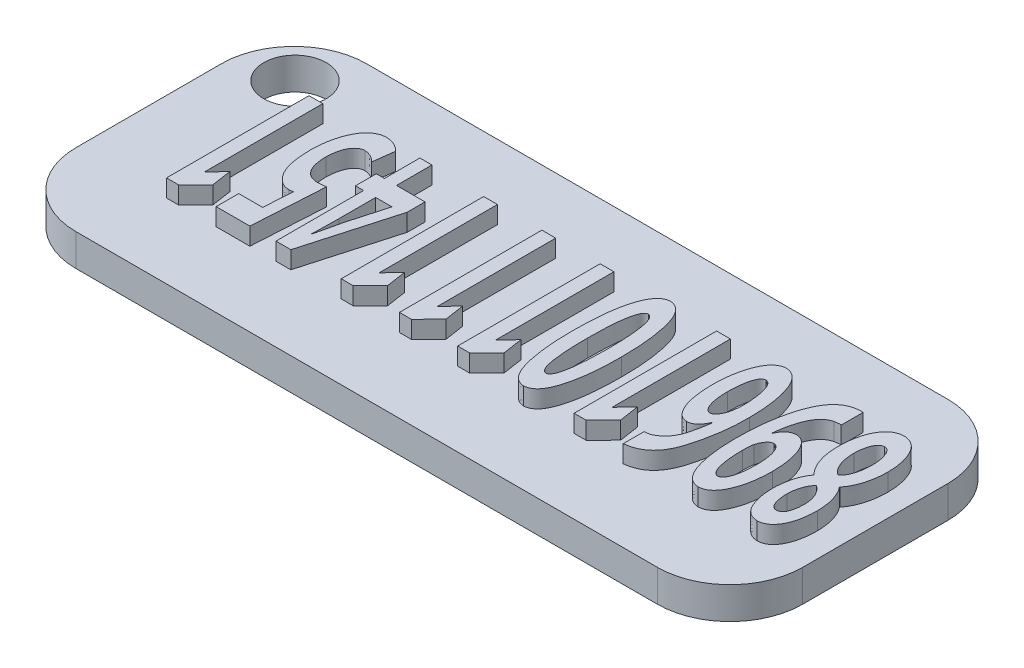
from build123d import *

# Parameters (mm, degrees)
SKETCH_1_W          = 50
SKETCH_1_H          = 20
EXTRUDE_1_DEPTH     = 2.2
FILLET_1_R          = 5
FILLET_2_R          = 5
FILLET_3_R          = 5
FILLET_4_R          = 5
SKETCH_4_R          = 2.151855383
CUT_EXTRUDE_1_DEPTH = 3
EXTRUDE_START       = -1.2
EXTRUDE_1056_DEPTH  = 1.2


# Read off the part's stored shape, not the designer's step: надпись
with BuildPart() as part:
    # Эскиз1 → Бобышка-Вытянуть1 (new body)
    with BuildSketch(Plane(origin=(0, 0, 0), x_dir=(1, 0, 0), z_dir=(0, 1, 0))):
        with Locations((25, 10)):
            Rectangle(SKETCH_1_W, SKETCH_1_H)
    extrude(amount=EXTRUDE_1_DEPTH)

    # Скругление1
    fillet_1_edges = [part.edges().sort_by_distance(p)[0] for p in [
        (0, 1.1, -20),
    ]]
    fillet(fillet_1_edges, radius=FILLET_1_R)

    # Скругление2
    fillet_2_edges = [part.edges().sort_by_distance(p)[0] for p in [
        (0, 1.1, 0),
    ]]
    fillet(fillet_2_edges, radius=FILLET_2_R)

    # Скругление3
    fillet_3_edges = [part.edges().sort_by_distance(p)[0] for p in [
        (50, 1.1, -20),
    ]]
    fillet(fillet_3_edges, radius=FILLET_3_R)

    # Скругление4
    fillet_4_edges = [part.edges().sort_by_distance(p)[0] for p in [
        (50, 1.1, 0),
    ]]
    fillet(fillet_4_edges, radius=FILLET_4_R)

    # Эскиз4 → Вырез-Вытянуть1 (cut)
    with BuildSketch(Plane(origin=(0, 2.2, 0), x_dir=(1, 0, 0), z_dir=(0, 1, 0))):
        with Locations(Location((3.542470198, 16.528352227, 0), (0, 0, 270))):
            Circle(SKETCH_4_R)
    extrude(amount=-CUT_EXTRUDE_1_DEPTH, mode=Mode.SUBTRACT)

    # Extrude 1056 outline → Extrude 1056 (add)
    # profile 1 of 11: a face of its own
    with BuildSketch(Plane.XZ.offset(-2.2).offset(EXTRUDE_START)):
        with BuildLine():
            add(Edge.make_bspline(
                [(46.078309947, -9.677843866), (46.027974113, -9.605172508), (45.925734825, -9.457566573), (45.797719515, -9.21403545), (45.690766361, -8.949790128), (45.605330166, -8.667262078), (45.538818282, -8.374682095), (45.489532793, -8.076942657), (45.45786786, -7.777208198), (45.454564992, -7.576119586), (45.452912137, -7.475488811)],
                knots=[0, 0, 0, 0, 0.113941103, 0.2314307, 0.353960198, 0.481139313, 0.611706454, 0.740704099, 0.870240551, 1, 1, 1, 1], degree=3))
            Line((46.078309947, -9.677843866), (46.078854937, -9.703996008))
            add(Edge.make_bspline(
                [(45.211584793, -12.207767208), (45.21631399, -12.061200702), (45.225433942, -11.778556663), (45.273766155, -11.372768263), (45.352120596, -11.002667897), (45.459635252, -10.669550107), (45.589719445, -10.373513923), (45.734618791, -10.113421233), (45.894005329, -9.888382936), (46.01865144, -9.764048816), (46.078854937, -9.703996008)],
                knots=[0, 0, 0, 0, 0.161686258, 0.311801503, 0.450067459, 0.578302134, 0.697174596, 0.806108895, 0.906351489, 1, 1, 1, 1], degree=3))
            add(Edge.make_bspline(
                [(46.863168807, -15.113122193), (46.80262288, -15.109171079), (46.684044908, -15.101432903), (46.511067483, -15.060678112), (46.347933835, -14.995360647), (46.191896755, -14.909032346), (46.047301537, -14.794897335), (45.911617757, -14.658556004), (45.784541788, -14.498597289), (45.668579213, -14.315558168), (45.563753042, -14.112223731), (45.470997983, -13.891170782), (45.394091896, -13.651866208), (45.330756558, -13.395988548), (45.279593831, -13.122797621), (45.242938773, -12.833195306), (45.217255905, -12.526213109), (45.213510802, -12.315917003), (45.211584793, -12.207767208)],
                knots=[0, 0, 0, 0, 0.04935732, 0.096665312, 0.144003759, 0.192132698, 0.241383724, 0.293506514, 0.348508342, 0.407438452, 0.469713062, 0.534644972, 0.602472394, 0.674232576, 0.749229871, 0.828723586, 0.911917015, 1, 1, 1, 1], degree=3))
            add(Edge.make_bspline(
                [(48.454420985, -12.428355484), (48.452674256, -12.516993812), (48.449226519, -12.691950305), (48.430923326, -12.949468758), (48.398000408, -13.197850059), (48.355874941, -13.436766086), (48.298960072, -13.665970943), (48.22900655, -13.885768002), (48.146139953, -14.095954879), (48.053448211, -14.295680741), (47.946991827, -14.478130498), (47.827908731, -14.639709615), (47.697781171, -14.778860945), (47.554387512, -14.893967333), (47.398514091, -14.984872048), (47.231251794, -15.053623861), (47.051286399, -15.097807415), (46.926883157, -15.107935165), (46.863168807, -15.113122193)],
                knots=[0, 0, 0, 0, 0.077214743, 0.152408342, 0.224719305, 0.295370231, 0.363611314, 0.430261871, 0.496132333, 0.560288229, 0.621875218, 0.679791288, 0.734777273, 0.787353525, 0.839365363, 0.891411757, 0.944385459, 1, 1, 1, 1], degree=3))
            add(Edge.make_bspline(
                [(47.695145343, -9.85936227), (47.747554237, -9.926459085), (47.856031089, -10.065337253), (47.992318934, -10.306361212), (48.120543883, -10.577558027), (48.235291236, -10.883599416), (48.332007715, -11.222904393), (48.400135986, -11.596003837), (48.444033938, -12.001236193), (48.450872319, -12.282433004), (48.454420985, -12.428355484)],
                knots=[0, 0, 0, 0, 0.093486626, 0.193500263, 0.303527542, 0.423128014, 0.552388557, 0.690879033, 0.839586736, 1, 1, 1, 1], degree=3))
            Line((47.695145343, -9.85936227), (47.696502294, -9.820888941))
            add(Edge.make_bspline(
                [(48.333757313, -7.669681908), (48.332400882, -7.773485108), (48.329714157, -7.979091408), (48.294470298, -8.282880004), (48.248183965, -8.579721921), (48.175551215, -8.86483122), (48.087174996, -9.135586497), (47.976756913, -9.385857701), (47.850277624, -9.616246555), (47.747160445, -9.753473674), (47.696502294, -9.820888941)],
                knots=[0, 0, 0, 0, 0.136247325, 0.26986941, 0.401216199, 0.530532356, 0.655813574, 0.774814705, 0.889373711, 1, 1, 1, 1], degree=3))
            add(Edge.make_bspline(
                [(46.853741958, -5.003768899), (46.90797993, -5.007260305), (47.014463515, -5.014114866), (47.169787234, -5.050784431), (47.315929588, -5.110360712), (47.455258419, -5.189599), (47.583778459, -5.293674812), (47.705715522, -5.417268753), (47.817999658, -5.563759963), (47.924291395, -5.729516874), (48.016616167, -5.916192509), (48.100737096, -6.118543686), (48.169034399, -6.33794704), (48.228390088, -6.572481678), (48.272394452, -6.824061429), (48.306605506, -7.091379936), (48.326940882, -7.375267295), (48.331443098, -7.569726588), (48.333757313, -7.669681908)],
                knots=[0, 0, 0, 0, 0.048503693, 0.095225668, 0.141839522, 0.189135082, 0.237898156, 0.289124475, 0.343943217, 0.402519234, 0.464803107, 0.529773363, 0.598149215, 0.669927247, 0.745822609, 0.826203937, 0.910665924, 1, 1, 1, 1], degree=3))
            add(Edge.make_bspline(
                [(45.452912137, -7.475488811), (45.456739433, -7.319432744), (45.464194853, -7.015441717), (45.526511786, -6.573878797), (45.63311746, -6.161319712), (45.753938359, -5.83962289), (45.873267915, -5.604845892), (45.977498211, -5.452969286), (46.093544961, -5.323103196), (46.221115754, -5.213766333), (46.361470193, -5.126354365), (46.514657083, -5.061353085), (46.680172404, -5.019646003), (46.795068916, -5.009135957), (46.853741958, -5.003768899)],
                knots=[0, 0, 0, 0, 0.14929621, 0.290823096, 0.425604597, 0.556392853, 0.618800505, 0.677186811, 0.732126157, 0.785029691, 0.837431757, 0.889709436, 0.943679032, 1, 1, 1, 1], degree=3))
        make_face()
        with BuildLine():
            add(Edge.make_bspline(
                [(46.161811212, -12.362367538), (46.163759344, -12.457382745), (46.167514338, -12.640523049), (46.202428312, -12.9042703), (46.256201504, -13.146406235), (46.3292193, -13.363319376), (46.421100573, -13.54734881), (46.538282039, -13.686539035), (46.679667922, -13.777266891), (46.784568197, -13.793060782), (46.836544836, -13.80087038)],
                knots=[0, 0, 0, 0, 0.165153543, 0.318330835, 0.461763472, 0.595861741, 0.715629486, 0.817101713, 0.909318156, 0.99986714, 0.99986714, 0.99986714, 0.99986714], degree=3))
            add(Edge.make_bspline(
                [(46.914073794, -10.509048947), (46.86044007, -10.548203883), (46.750645538, -10.628358636), (46.609486585, -10.785243872), (46.482183681, -10.970250236), (46.371339819, -11.186804007), (46.277961057, -11.434662914), (46.214225457, -11.716286991), (46.172416068, -12.028695365), (46.165451114, -12.247841318), (46.161811212, -12.362367538)],
                knots=[0, 0, 0, 0, 0.095604842, 0.195714339, 0.302624958, 0.419033209, 0.545871774, 0.683790463, 0.83474811, 1, 1, 1, 1], degree=3))
            add(Edge.make_bspline(
                [(47.504194566, -12.245474606), (47.501605234, -12.149267424), (47.496550758, -11.961467335), (47.469393374, -11.687559734), (47.419429409, -11.430678791), (47.355280098, -11.191444527), (47.271814748, -10.975113826), (47.170826099, -10.787544871), (47.053714874, -10.629827493), (46.959591571, -10.548418242), (46.914073794, -10.509048947)],
                knots=[0, 0, 0, 0, 0.152677995, 0.29803327, 0.436098728, 0.567455095, 0.690591438, 0.803037348, 0.90474939, 1, 1, 1, 1], degree=3))
            add(Edge.make_bspline(
                [(46.836544836, -13.80087038), (46.86261082, -13.798162612), (46.913863854, -13.792811886), (46.987088364, -13.766571208), (47.056547102, -13.729238508), (47.117966898, -13.673680896), (47.180206287, -13.610280654), (47.232947149, -13.529565327), (47.285573124, -13.438614817), (47.344553499, -13.294330749), (47.410925257, -13.095175517), (47.463520234, -12.833038866), (47.498548764, -12.547453652), (47.502265453, -12.348657789), (47.504194566, -12.245474606)],
                knots=[0.000181514, 0.000181514, 0.000181514, 0.000181514, 0.043073183, 0.084527609, 0.127035215, 0.1717059, 0.219898678, 0.272580112, 0.329424805, 0.392311346, 0.528096431, 0.673647876, 0.8306099, 1, 1, 1, 1], degree=3))
        make_face(mode=Mode.SUBTRACT)
        with BuildLine():
            add(Edge.make_bspline(
                [(47.504194566, -7.579184154), (47.503195757, -7.499277873), (47.501255068, -7.344019773), (47.473234473, -7.117775601), (47.431519103, -6.903753043), (47.369090488, -6.707727668), (47.290569229, -6.53547269), (47.182295761, -6.403004689), (47.043184988, -6.318466445), (46.940284878, -6.303102084), (46.887678615, -6.295247266)],
                knots=[0, 0, 0, 0, 0.153851589, 0.298934016, 0.438563176, 0.573351932, 0.694652626, 0.801164328, 0.898348004, 1, 1, 1, 1], degree=3))
            add(Edge.make_bspline(
                [(46.81226382, -9.134614305), (46.862439152, -9.096350175), (46.963589503, -9.019212066), (47.096313583, -8.876918569), (47.213065342, -8.713564267), (47.315895318, -8.52958974), (47.398878962, -8.323302575), (47.458545593, -8.094677067), (47.497098, -7.844424879), (47.501769248, -7.669832657), (47.504194566, -7.579184154)],
                knots=[0, 0, 0, 0, 0.106825906, 0.215354388, 0.328311063, 0.44659403, 0.571831886, 0.704152423, 0.846395563, 1, 1, 1, 1], degree=3))
            add(Edge.make_bspline(
                [(46.282474884, -7.64328673), (46.285542594, -7.725718472), (46.291533991, -7.886711995), (46.322755467, -8.121747951), (46.368092179, -8.344452345), (46.434989814, -8.55067455), (46.511234044, -8.737323134), (46.60109943, -8.897440638), (46.696643827, -9.032946341), (46.775094048, -9.101929862), (46.81226382, -9.134614305)],
                knots=[0, 0, 0, 0, 0.152064887, 0.296990713, 0.436806136, 0.570611067, 0.696334438, 0.80790798, 0.908986661, 1, 1, 1, 1], degree=3))
            add(Edge.make_bspline(
                [(46.886500259, -6.293647279), (46.83538083, -6.301938363), (46.734376801, -6.318320253), (46.600140532, -6.408312885), (46.493740845, -6.543789202), (46.41679896, -6.722317663), (46.358261152, -6.92709015), (46.311903706, -7.152013712), (46.285864996, -7.392535246), (46.283622758, -7.558383626), (46.282474884, -7.64328673)],
                knots=[0, 0, 0, 0, 0.095691051, 0.189070611, 0.29330398, 0.413483092, 0.549311339, 0.690551989, 0.841583641, 1, 1, 1, 1], degree=3))
            Line((46.886500259, -6.293647279), (46.887678615, -6.295247266))
        make_face(mode=Mode.SUBTRACT)
    # profile 2 of 11: a face of its own
    with BuildSketch(Plane.XZ.offset(-2.2).offset(EXTRUDE_START)):
        with BuildLine():
            add(Edge.make_bspline(
                [(44.04725437, -15.11174683), (43.987385205, -15.114070393), (43.868898808, -15.118668932), (43.693434551, -15.103937408), (43.523252435, -15.077828695), (43.358741609, -15.039003764), (43.201388033, -14.983318238), (43.050111553, -14.915129471), (42.903936107, -14.834674512), (42.766996185, -14.736787277), (42.632629914, -14.629426485), (42.508059907, -14.504726533), (42.38788946, -14.367318384), (42.273368197, -14.217136563), (42.16508345, -14.052358087), (42.066568067, -13.872002181), (41.96939987, -13.68052939), (41.851289199, -13.402249017), (41.717343953, -13.031760823), (41.577455337, -12.561667209), (41.462107324, -12.061386408), (41.365507994, -11.533031322), (41.293318956, -10.975995836), (41.240314731, -10.390514117), (41.210397464, -9.775330417), (41.207191415, -9.35523444), (41.205550872, -9.140270414)],
                knots=[0, 0, 0, 0, 0.024487623, 0.048463181, 0.07187814, 0.09488595, 0.117488049, 0.140040387, 0.162712552, 0.185605178, 0.208811761, 0.232989069, 0.257583726, 0.28344624, 0.310184461, 0.338150104, 0.367466745, 0.397981826, 0.461741489, 0.528520028, 0.598484453, 0.671649595, 0.748146436, 0.828163951, 0.91207112, 1, 1, 1, 1], degree=3))
            Line((44.04725437, -15.11174683), (44.048688651, -13.601055549))
            add(Edge.make_bspline(
                [(43.579231551, -13.561462782), (43.61258245, -13.566861786), (43.67367764, -13.576752169), (43.756732427, -13.593836438), (43.824452891, -13.601489775), (43.891708091, -13.613413366), (43.965642464, -13.61504435), (44.021131507, -13.605697441), (44.048688651, -13.601055549)],
                knots=[0, 0, 0, 0, 0.213719524, 0.39151073, 0.53600369, 0.644514602, 0.823457719, 1, 1, 1, 1], degree=3))
            add(Edge.make_bspline(
                [(42.143203863, -10.732850085), (42.152913081, -10.826145832), (42.171961613, -11.009182943), (42.213021068, -11.276889607), (42.256329034, -11.533427069), (42.312327657, -11.777714281), (42.373431464, -12.010753199), (42.443989973, -12.232601603), (42.520328195, -12.443143418), (42.604992277, -12.640929958), (42.696024941, -12.824197987), (42.797560211, -12.98838531), (42.907535712, -13.132919259), (43.024857499, -13.258958894), (43.151200313, -13.365300223), (43.286637025, -13.450625789), (43.428878747, -13.518420365), (43.529094466, -13.547109732), (43.579231551, -13.561462782)],
                knots=[0, 0, 0, 0, 0.083749371, 0.164308055, 0.241812066, 0.316015091, 0.388027431, 0.456894199, 0.523829033, 0.58793985, 0.648928779, 0.706394687, 0.760048322, 0.810868126, 0.859873756, 0.907048861, 0.953497323, 1, 1, 1, 1], degree=3))
            Line((42.143203863, -10.732850085), (42.163318771, -10.720210373))
            add(Edge.make_bspline(
                [(43.094691492, -11.489441284), (43.044787182, -11.486183321), (42.945933546, -11.479729739), (42.803226891, -11.439100379), (42.670705849, -11.373559165), (42.548260623, -11.283451948), (42.439085027, -11.168339541), (42.333351592, -11.038338918), (42.241947327, -10.886319281), (42.190018525, -10.776615668), (42.163318771, -10.720210373)],
                knots=[0, 0, 0, 0, 0.116925784, 0.23161404, 0.344884987, 0.461810772, 0.58572325, 0.71565789, 0.85380244, 1, 1, 1, 1], degree=3))
            add(Edge.make_bspline(
                [(44.446501695, -8.465307997), (44.444301581, -8.579725962), (44.440018776, -8.802455229), (44.418138685, -9.126841338), (44.389744776, -9.432845618), (44.346232134, -9.719112434), (44.291514129, -9.986576149), (44.226515668, -10.234971415), (44.149036141, -10.464286834), (44.061521886, -10.673296099), (43.963022591, -10.859813171), (43.86081538, -11.024451663), (43.750302846, -11.165118524), (43.632325733, -11.27981019), (43.50792487, -11.371672429), (43.375998762, -11.435440305), (43.238321206, -11.480471442), (43.142806007, -11.486436477), (43.094691492, -11.489441284)],
                knots=[0, 0, 0, 0, 0.095610673, 0.186118458, 0.27160428, 0.352333468, 0.42792741, 0.499640582, 0.56673059, 0.630030627, 0.688754273, 0.74280495, 0.791766595, 0.837817092, 0.879939355, 0.920333827, 0.959869222, 1, 1, 1, 1], degree=3))
            add(Edge.make_bspline(
                [(42.81188601, -4.994342049), (42.873943174, -5.000099892), (42.997342197, -5.011549209), (43.174435585, -5.071753842), (43.341841896, -5.156147597), (43.497681637, -5.27312241), (43.642287555, -5.41903082), (43.776639778, -5.595135643), (43.901300582, -5.799757373), (44.011533243, -6.03278609), (44.113476948, -6.28555358), (44.198583084, -6.556030295), (44.274785722, -6.839444532), (44.337084136, -7.137093239), (44.382818759, -7.449561619), (44.419726254, -7.775163248), (44.439445614, -8.115654083), (44.444116993, -8.347137517), (44.446501695, -8.465307997)],
                knots=[0, 0, 0, 0, 0.044788294, 0.089060333, 0.133839461, 0.179508177, 0.228843309, 0.281493248, 0.338836435, 0.401246252, 0.467120147, 0.535176432, 0.605509425, 0.678636709, 0.754243913, 0.833093643, 0.914795611, 1, 1, 1, 1], degree=3))
            add(Edge.make_bspline(
                [(41.205550872, -9.140270414), (41.207264897, -8.991309733), (41.210614758, -8.700183418), (41.228928778, -8.27442403), (41.26139615, -7.870179001), (41.303851059, -7.487012124), (41.35985007, -7.12516581), (41.429753321, -6.785560877), (41.510350616, -6.467461477), (41.603134364, -6.172814895), (41.708826173, -5.906123561), (41.827749924, -5.671195277), (41.958955197, -5.470530026), (42.102547312, -5.302101472), (42.26283362, -5.173038944), (42.433532632, -5.075831142), (42.618009403, -5.01296775), (42.746684608, -5.000605939), (42.81188601, -4.994342049)],
                knots=[0, 0, 0, 0, 0.093043437, 0.181842568, 0.266109144, 0.34630305, 0.422583728, 0.494716837, 0.562788119, 0.627465506, 0.6875281, 0.741774322, 0.791636758, 0.836982325, 0.879404895, 0.919475901, 0.959197391, 1, 1, 1, 1], degree=3))
        make_face()
        with BuildLine():
            add(Edge.make_bspline(
                [(43.501931386, -8.291853969), (43.499172297, -8.153522521), (43.493908565, -7.889616713), (43.460775977, -7.513375446), (43.405536667, -7.177101272), (43.340129957, -6.924955276), (43.279157951, -6.746836863), (43.227842301, -6.634724435), (43.176350338, -6.536377609), (43.117340877, -6.457508469), (43.056964627, -6.392355076), (42.99033886, -6.347000991), (42.91982955, -6.316280085), (42.870621648, -6.309816763), (42.845822668, -6.306559485)],
                knots=[0, 0, 0, 0, 0.187002657, 0.356759712, 0.510118111, 0.647153892, 0.708418131, 0.764316503, 0.813745831, 0.85809532, 0.897148384, 0.933203113, 0.966336816, 1, 1, 1, 1], degree=3))
            add(Edge.make_bspline(
                [(42.832625079, -10.186650697), (42.857327254, -10.184568066), (42.906667609, -10.1804082), (42.978465354, -10.154699735), (43.044277372, -10.112341419), (43.106396021, -10.054870548), (43.165721311, -9.984224083), (43.221107135, -9.897287482), (43.271162554, -9.795137333), (43.33631677, -9.632755834), (43.402506594, -9.394999705), (43.459803499, -9.070602549), (43.494534602, -8.697313717), (43.499373301, -8.432077134), (43.501931386, -8.291853969)],
                knots=[0, 0, 0, 0, 0.03448244, 0.068875547, 0.105130244, 0.143003502, 0.186571321, 0.233520861, 0.286467941, 0.345095043, 0.477485255, 0.629894425, 0.804335531, 1, 1, 1, 1], degree=3))
            add(Edge.make_bspline(
                [(42.208567648, -9.430617376), (42.238302449, -9.525684566), (42.295931093, -9.709933092), (42.4157911, -9.915830309), (42.528538944, -10.050337156), (42.621005158, -10.125337554), (42.723563966, -10.173398169), (42.796336215, -10.182241067), (42.832625079, -10.186650697)],
                knots=[0, 0, 0, 0, 0.286215616, 0.554710882, 0.6791684, 0.78996751, 0.895264466, 1, 1, 1, 1], degree=3))
            add(Edge.make_bspline(
                [(42.155777292, -8.702864602), (42.155368544, -8.74812072), (42.154596287, -8.833624136), (42.15968612, -8.954239716), (42.162435199, -9.060539025), (42.170279424, -9.177455748), (42.179085395, -9.300512339), (42.199485933, -9.390539813), (42.208567648, -9.430617376)],
                knots=[0, 0, 0, 0, 0.185634103, 0.350722746, 0.495196877, 0.621767754, 0.831622217, 1, 1, 1, 1], degree=3))
            add(Edge.make_bspline(
                [(42.844590917, -6.304677798), (42.81632972, -6.308919917), (42.759015095, -6.317523072), (42.678836933, -6.357293238), (42.605990003, -6.416423603), (42.536602226, -6.493216758), (42.476050485, -6.592472346), (42.419178939, -6.710531156), (42.368846462, -6.849011498), (42.308227289, -7.066665145), (42.244553984, -7.373100249), (42.194071408, -7.777220869), (42.161821034, -8.225345058), (42.15785408, -8.538776352), (42.155777292, -8.702864602)],
                knots=[0, 0, 0, 0, 0.032360413, 0.065627968, 0.100251475, 0.138736479, 0.182780166, 0.232036785, 0.287698539, 0.350174283, 0.489029732, 0.64337453, 0.813298638, 1, 1, 1, 1], degree=3))
            Line((42.844590917, -6.304677798), (42.845822668, -6.306559485))
        make_face(mode=Mode.SUBTRACT)
    # profile 3 of 11: a face of its own
    with BuildSketch(Plane.XZ.offset(-2.2).offset(EXTRUDE_START)):
        with BuildLine():
            add(Edge.make_bspline(
                [(37.658547441, -4.99245852), (37.726922327, -5.000842151), (37.861637389, -5.017359931), (38.058425719, -5.059843138), (38.247499293, -5.113430065), (38.426873653, -5.183948537), (38.598134167, -5.267130332), (38.760120626, -5.365256171), (38.913415919, -5.477562867), (39.059709851, -5.601709045), (39.194926697, -5.742653389), (39.324238774, -5.895297946), (39.4424425, -6.063686791), (39.552321574, -6.245932206), (39.653506152, -6.442156459), (39.747993584, -6.651435488), (39.833316335, -6.874836651), (39.931051729, -7.19079218), (40.041103616, -7.593351611), (40.155792023, -8.076997935), (40.253291337, -8.556502389), (40.327327869, -9.032364407), (40.387533813, -9.503692343), (40.424191061, -9.971800935), (40.444476829, -10.435967264), (40.441800117, -10.744074101), (40.440467775, -10.897435142)],
                knots=[0, 0, 0, 0, 0.028917775, 0.056975011, 0.084456505, 0.111365472, 0.137806966, 0.164332636, 0.190782033, 0.217549533, 0.244800648, 0.27271475, 0.301495134, 0.331098834, 0.36202831, 0.394160803, 0.427493649, 0.462385715, 0.533013785, 0.602731, 0.671109872, 0.738455515, 0.804945942, 0.87061564, 0.935598573, 1, 1, 1, 1], degree=3))
            Line((37.658547441, -4.99245852), (37.659547203, -6.427223158))
            add(Edge.make_bspline(
                [(38.078099316, -6.493211103), (38.003711515, -6.474254325), (37.866181832, -6.439206647), (37.72456538, -6.430993797), (37.659547203, -6.427223158)],
                knots=[0, 0, 0, 0, 0.540885423, 1, 1, 1, 1], degree=3))
            add(Edge.make_bspline(
                [(39.463846178, -9.345775731), (39.467568961, -9.328869498), (39.477257079, -9.284872963), (39.47334457, -9.200794399), (39.462152455, -9.086412778), (39.43732455, -8.940923647), (39.408378535, -8.763299028), (39.366342321, -8.554652248), (39.312254309, -8.314993926), (39.254260162, -8.051435064), (39.181628292, -7.782270601), (39.083518721, -7.528948463), (38.965481169, -7.298678136), (38.830683068, -7.089418275), (38.671687462, -6.904801036), (38.494404053, -6.742113431), (38.296356332, -6.601769278), (38.151436395, -6.529688004), (38.078099316, -6.493211103)],
                knots=[0, 0, 0, 0, 0.015495237, 0.04032458, 0.074913193, 0.118889038, 0.172696469, 0.236552562, 0.309940194, 0.39330633, 0.478881574, 0.559992191, 0.636714608, 0.710902782, 0.782943777, 0.854838757, 0.926540807, 1, 1, 1, 1], degree=3))
            add(Edge.make_bspline(
                [(38.524931978, -8.493588546), (38.574885421, -8.497322668), (38.67352381, -8.50469609), (38.817110207, -8.549788955), (38.950679791, -8.625518892), (39.074412421, -8.728082661), (39.187735702, -8.854281448), (39.29083766, -9.000407958), (39.386165286, -9.164632945), (39.437442847, -9.284206241), (39.463846178, -9.345775731)],
                knots=[0, 0, 0, 0, 0.111502154, 0.220172867, 0.332544669, 0.452131387, 0.577215859, 0.709913914, 0.850631761, 1, 1, 1, 1], degree=3))
            add(Edge.make_bspline(
                [(37.203287692, -11.585595148), (37.205814417, -11.466174094), (37.210737744, -11.233482061), (37.228113791, -10.894931228), (37.261306269, -10.57752642), (37.301303797, -10.281564087), (37.354434965, -10.006573748), (37.417463762, -9.75253814), (37.492831803, -9.51931701), (37.579137932, -9.308137608), (37.674258227, -9.120061212), (37.777088674, -8.95645015), (37.883091596, -8.81503011), (37.99930966, -8.700812235), (38.120779171, -8.610306244), (38.249270067, -8.544707545), (38.384827851, -8.503405447), (38.478148756, -8.496866581), (38.524931978, -8.493588546)],
                knots=[0, 0, 0, 0, 0.098437326, 0.19180522, 0.279258748, 0.361365344, 0.437849901, 0.509951347, 0.5769384, 0.639646388, 0.69778416, 0.750377086, 0.798754049, 0.843068062, 0.884192353, 0.923104738, 0.961451209, 1, 1, 1, 1], degree=3))
            add(Edge.make_bspline(
                [(38.768144692, -15.101809973), (38.708620198, -15.095226544), (38.590270604, -15.082137038), (38.419970908, -15.022831398), (38.258859442, -14.934995789), (38.109937641, -14.81418327), (37.971072703, -14.664625538), (37.84246001, -14.485152234), (37.724753397, -14.27549672), (37.618716815, -14.038248446), (37.524154502, -13.779443997), (37.439519371, -13.505144077), (37.3676743, -13.217532726), (37.309841276, -12.916534777), (37.262583408, -12.60273583), (37.228930871, -12.274966033), (37.207881094, -11.934663907), (37.204834564, -11.703147358), (37.203287692, -11.585595148)],
                knots=[0, 0, 0, 0, 0.043114492, 0.0857224, 0.129169754, 0.175009708, 0.223475043, 0.276107523, 0.334009294, 0.396747491, 0.463491163, 0.532800387, 0.603879069, 0.677369327, 0.753974902, 0.832881902, 0.915146015, 1, 1, 1, 1], degree=3))
            add(Edge.make_bspline(
                [(40.440467775, -10.897435142), (40.438939153, -11.047032503), (40.435944641, -11.340088054), (40.414943734, -11.768947738), (40.381594257, -12.176502674), (40.33446684, -12.562697555), (40.274604164, -12.928258525), (40.201748209, -13.273250056), (40.114860519, -13.596743351), (40.016602913, -13.897103843), (39.905189629, -14.169473545), (39.780903501, -14.409523207), (39.644537084, -14.614725161), (39.4930648, -14.783739261), (39.331480051, -14.920477136), (39.154204863, -15.017585487), (38.966136672, -15.083771947), (38.834670026, -15.095749194), (38.768144692, -15.101809973)],
                knots=[0, 0, 0, 0, 0.091842478, 0.179915928, 0.263545873, 0.34284573, 0.418709817, 0.490903859, 0.559227746, 0.62426067, 0.684807781, 0.739689122, 0.78998592, 0.835614457, 0.878643642, 0.919230088, 0.959128452, 1, 1, 1, 1], degree=3))
        make_face()
        with BuildLine():
            add(Edge.make_bspline(
                [(38.147858002, -11.677978272), (38.150117501, -11.813787438), (38.154454159, -12.074445982), (38.184667003, -12.447794796), (38.232038862, -12.787095877), (38.290626149, -13.045132803), (38.346298212, -13.229530439), (38.392789961, -13.34737282), (38.446196063, -13.446838568), (38.499897907, -13.532755387), (38.562002338, -13.598662283), (38.628336386, -13.647736346), (38.698813837, -13.682444631), (38.749603449, -13.688495167), (38.774833809, -13.691453378)],
                knots=[0, 0, 0, 0, 0.182155693, 0.349611438, 0.502089811, 0.641348814, 0.704008419, 0.76036267, 0.810892766, 0.855315926, 0.895867078, 0.931442779, 0.965768034, 0.999618805, 0.999618805, 0.999618805, 0.999618805], degree=3))
            add(Edge.make_bspline(
                [(38.819049679, -9.805805982), (38.792414488, -9.809099163), (38.739640895, -9.815624101), (38.663583874, -9.84539512), (38.593702566, -9.892197318), (38.526396859, -9.952475556), (38.468915232, -10.032311131), (38.413681434, -10.125523659), (38.363309296, -10.234849391), (38.302459032, -10.405767682), (38.239519065, -10.645709073), (38.18558043, -10.961057379), (38.154207753, -11.309071202), (38.150033384, -11.551593159), (38.147858002, -11.677978272)],
                knots=[0, 0, 0, 0, 0.03774489, 0.074785778, 0.113880584, 0.155919741, 0.201484143, 0.251957916, 0.308670591, 0.370925099, 0.507684398, 0.657938756, 0.821742123, 1, 1, 1, 1], degree=3))
            add(Edge.make_bspline(
                [(39.495897466, -11.40459964), (39.493784509, -11.33796805), (39.48969461, -11.208994074), (39.477261578, -11.022688995), (39.456149777, -10.85040378), (39.42996259, -10.691841348), (39.398746624, -10.546021923), (39.359241702, -10.414430098), (39.314163268, -10.296346994), (39.248818854, -10.163947182), (39.162435288, -10.027406926), (39.051965431, -9.904561122), (38.939226735, -9.820417706), (38.857180904, -9.810442166), (38.819049679, -9.805805982)],
                knots=[0, 0, 0, 0, 0.10763651, 0.208344253, 0.301355632, 0.38776755, 0.46778231, 0.541939973, 0.609401456, 0.671573032, 0.780218806, 0.868545787, 0.938905973, 1, 1, 1, 1], degree=3))
            add(Edge.make_bspline(
                [(38.774833809, -13.691453378), (38.803186084, -13.687987645), (38.860456422, -13.680897571), (38.940223533, -13.642032575), (39.016051014, -13.588456269), (39.08427848, -13.512611142), (39.144899543, -13.417167143), (39.204670182, -13.304963931), (39.255784317, -13.172085435), (39.323139368, -12.964935589), (39.38968559, -12.671706325), (39.446717824, -12.28593354), (39.484363334, -11.859041404), (39.491939627, -11.560537455), (39.495897466, -11.40459964)],
                knots=[0.000322198, 0.000322198, 0.000322198, 0.000322198, 0.033841756, 0.068058078, 0.103694108, 0.143089669, 0.187556951, 0.237027091, 0.292987501, 0.355425327, 0.494235183, 0.647393783, 0.815799276, 1, 1, 1, 1], degree=3))
        make_face(mode=Mode.SUBTRACT)
    # profile 4 of 11: a face of its own
    with BuildSketch(Plane.XZ.offset(-2.2).offset(EXTRUDE_START)):
        with BuildLine():
            add(Edge.make_bspline(
                [(30.815333438, -15.101809973), (30.752337114, -15.09638161), (30.625951818, -15.085491049), (30.443371847, -15.01868558), (30.27422144, -14.908811333), (30.116408841, -14.759422894), (29.974208648, -14.566701686), (29.839840184, -14.33684957), (29.718801698, -14.065712383), (29.608828963, -13.755863084), (29.508769342, -13.409193068), (29.426236603, -13.025732465), (29.352138741, -12.608293788), (29.292899893, -12.15591364), (29.2460147, -11.66856733), (29.212854706, -11.146674152), (29.191832813, -10.589663148), (29.188940133, -10.206781024), (29.187449112, -10.009425929)],
                knots=[0, 0, 0, 0, 0.033109461, 0.06642529, 0.100865822, 0.138473422, 0.179945314, 0.226267604, 0.2781327, 0.335680383, 0.398904279, 0.467558637, 0.541656706, 0.621602041, 0.707188389, 0.798842127, 0.89631396, 1, 1, 1, 1], degree=3))
            Line((30.815333438, -15.101809973), (30.816408688, -15.101809973))
            add(Edge.make_bspline(
                [(32.430285305, -10.086726094), (32.430049831, -10.25831122), (32.429588244, -10.594660491), (32.411625288, -11.088138692), (32.384212033, -11.560997764), (32.343264728, -12.012552367), (32.288061051, -12.443776648), (32.222776229, -12.853881675), (32.145900531, -13.243461663), (32.056789812, -13.608118868), (31.956504895, -13.942186433), (31.837432591, -14.236088467), (31.707115174, -14.489470684), (31.559975541, -14.700168368), (31.39683136, -14.867821763), (31.217855959, -14.991663615), (31.023484186, -15.075757432), (30.885696646, -15.093092731), (30.816408688, -15.101809973)],
                knots=[0, 0, 0, 0, 0.091547972, 0.179456661, 0.263440314, 0.344257307, 0.421328872, 0.495367316, 0.565800515, 0.633142072, 0.695615521, 0.751721211, 0.802120328, 0.847339139, 0.888360757, 0.926217596, 0.962897719, 1, 1, 1, 1], degree=3))
            add(Edge.make_bspline(
                [(30.7843574, -5.005654268), (30.851702356, -5.012484701), (30.985892298, -5.026094857), (31.176756205, -5.105203556), (31.354594972, -5.221532839), (31.516503496, -5.383463747), (31.665428554, -5.584916244), (31.797846889, -5.829877383), (31.920662232, -6.114231056), (32.027495543, -6.439779921), (32.122184081, -6.799585126), (32.204034183, -7.188714477), (32.276846883, -7.604092372), (32.331392949, -8.047913084), (32.377158291, -8.5187241), (32.40847143, -9.017369504), (32.427655343, -9.54295639), (32.429394632, -9.902570919), (32.430285305, -10.086726094)],
                knots=[0, 0, 0, 0, 0.035432365, 0.07060168, 0.107362668, 0.146629638, 0.190325044, 0.238704697, 0.292737959, 0.353046496, 0.418707631, 0.488331289, 0.562123203, 0.640426583, 0.723437346, 0.810876272, 0.903151541, 1, 1, 1, 1], degree=3))
            add(Edge.make_bspline(
                [(29.187449112, -10.009425929), (29.187628723, -9.83846625), (29.187980777, -9.503367638), (29.206746637, -9.011224948), (29.231416147, -8.539569403), (29.270952248, -8.08868405), (29.323702387, -7.659276576), (29.387665745, -7.250492679), (29.463130943, -6.862499825), (29.546971064, -6.497128173), (29.647201184, -6.164136588), (29.760172739, -5.869060173), (29.892405567, -5.617603335), (30.038988504, -5.408078929), (30.200361974, -5.238370761), (30.380847125, -5.116430621), (30.575892019, -5.031316429), (30.714400129, -5.014266033), (30.7843574, -5.005654268)],
                knots=[0, 0, 0, 0, 0.091423284, 0.17919907, 0.263357202, 0.343996012, 0.421203867, 0.494696639, 0.565227649, 0.632567207, 0.695086524, 0.751072127, 0.801290447, 0.84661368, 0.887494442, 0.925716055, 0.962480882, 1, 1, 1, 1], degree=3))
        make_face()
        with BuildLine():
            add(Edge.make_bspline(
                [(30.137675532, -10.047133326), (30.137662342, -10.186029654), (30.137636734, -10.455688364), (30.148137672, -10.847230506), (30.161280839, -11.21300133), (30.176688821, -11.553232374), (30.202239, -11.867383211), (30.229624828, -12.156693129), (30.262955654, -12.42027127), (30.302835933, -12.657820879), (30.34479371, -12.869029514), (30.393351427, -13.052446275), (30.446840748, -13.208257337), (30.507435701, -13.335639631), (30.570124814, -13.438174671), (30.640487368, -13.51262204), (30.718857563, -13.561383273), (30.775598981, -13.567777839), (30.803211099, -13.570889631)],
                knots=[0, 0, 0, 0, 0.111876346, 0.21720107, 0.315472169, 0.406706071, 0.491501006, 0.5693244, 0.640778939, 0.705442812, 0.7633229, 0.814159852, 0.858189582, 0.895776399, 0.92765235, 0.954501245, 0.977858908, 1, 1, 1, 1], degree=3))
            add(Edge.make_bspline(
                [(30.797554989, -6.536574611), (30.769315469, -6.540357152), (30.711203546, -6.548140951), (30.631092323, -6.598099153), (30.560989159, -6.675722822), (30.495205618, -6.779129337), (30.436026406, -6.910851832), (30.381476691, -7.069801856), (30.336261562, -7.257708958), (30.292913208, -7.47144033), (30.255885265, -7.711195986), (30.223958491, -7.975298625), (30.198644613, -8.263370431), (30.175358247, -8.574425254), (30.159410117, -8.908908887), (30.145696699, -9.267121362), (30.138320099, -9.649288884), (30.137894448, -9.91201243), (30.137675532, -10.047133326)],
                knots=[0, 0, 0, 0, 0.02282151, 0.046962619, 0.074280081, 0.106979802, 0.145629234, 0.190785966, 0.242671978, 0.301768248, 0.367098558, 0.43876204, 0.516833704, 0.600899803, 0.690958447, 0.787572338, 0.890746694, 1, 1, 1, 1], degree=3))
            add(Edge.make_bspline(
                [(31.480058886, -10.047133326), (31.478681404, -9.905720785), (31.476017861, -9.632281081), (31.463888237, -9.235723213), (31.44973069, -8.866717887), (31.42929377, -8.524723037), (31.402389441, -8.209903763), (31.373620637, -7.921739256), (31.337055555, -7.661002482), (31.299089365, -7.427248661), (31.253421262, -7.22174442), (31.205893707, -7.04199042), (31.149514686, -6.891224861), (31.091954457, -6.764364414), (31.026466387, -6.666759457), (30.958373155, -6.591936222), (30.879977918, -6.546845111), (30.82442273, -6.539922528), (30.797554989, -6.536574611)],
                knots=[0, 0, 0, 0, 0.114262027, 0.220940622, 0.320549566, 0.412628422, 0.497726161, 0.575841092, 0.646576625, 0.710438676, 0.767113155, 0.81663727, 0.86049835, 0.897066001, 0.928894915, 0.95510868, 0.978289546, 1, 1, 1, 1], degree=3))
            add(Edge.make_bspline(
                [(30.808817497, -13.570889631), (30.83576213, -13.566913579), (30.891633626, -13.55866897), (30.969791228, -13.510949639), (31.039450829, -13.436461328), (31.103423219, -13.335455549), (31.162816968, -13.208647312), (31.216805344, -13.054997071), (31.264943093, -12.874474472), (31.309963053, -12.66755349), (31.349082932, -12.433448541), (31.381980433, -12.172314412), (31.413316429, -11.884590633), (31.433255757, -11.569314118), (31.456367391, -11.22763153), (31.467283954, -10.858511079), (31.477920642, -10.461974123), (31.479329996, -10.188545351), (31.480058886, -10.047133326)],
                knots=[0, 0, 0, 0, 0.021768481, 0.045138398, 0.072001378, 0.103468932, 0.141075468, 0.184651119, 0.234536993, 0.291561357, 0.355260178, 0.425747615, 0.503662887, 0.588464502, 0.680308007, 0.779642985, 0.886035652, 1, 1, 1, 1], degree=3))
            Line((30.808817497, -13.570889631), (30.803211099, -13.570889631))
        make_face(mode=Mode.SUBTRACT)
    # profile 5 of 11: a face of its own
    with BuildSketch(Plane.XZ.offset(-2.2).offset(EXTRUDE_START)):
        with BuildLine():
            add(Edge.make_bspline(
                [(12.150097983, -10.097629571), (12.066541927, -10.080350986), (11.886624464, -10.043145792), (11.702893489, -10.038375834), (11.604489615, -10.035821107)],
                knots=[0, 0, 0, 0, 0.464413266, 1, 1, 1, 1], degree=3))
            Line((12.150097983, -10.097629571), (11.854175924, -5.113122193))
            Line((11.854175924, -5.113122193), (9.532539924, -5.113122193))
            Line((9.532539924, -5.113122193), (9.532539924, -6.666668815))
            Line((9.532539924, -6.666668815), (11.178701659, -6.666668815))
            Line((11.178701659, -6.666668815), (11.308486544, -8.665157205))
            add(Edge.make_bspline(
                [(11.038878652, -8.625564437), (11.085665453, -8.626817487), (11.177133431, -8.629267193), (11.265379324, -8.653378888), (11.308486544, -8.665157205)],
                knots=[0, 0, 0, 0, 0.511510185, 1, 1, 1, 1], degree=3))
            add(Edge.make_bspline(
                [(9.398606856, -11.689290491), (9.401993504, -11.562928248), (9.408537818, -11.318747534), (9.434451436, -10.965686938), (9.475655512, -10.637743387), (9.531301901, -10.33543868), (9.60151064, -10.057774711), (9.682984777, -9.804857657), (9.78036805, -9.576898803), (9.894989812, -9.376389846), (10.016897107, -9.199215643), (10.145051984, -9.045129367), (10.279827594, -8.915482301), (10.420139227, -8.808978448), (10.565498375, -8.723793371), (10.718937122, -8.667597532), (10.876966755, -8.631858513), (10.984639649, -8.627672895), (11.038878652, -8.625564437)],
                knots=[0, 0, 0, 0, 0.099198525, 0.191689906, 0.277705182, 0.358481385, 0.432768817, 0.502332918, 0.566838129, 0.626914593, 0.683282794, 0.73544596, 0.783935368, 0.829707165, 0.873448831, 0.915590078, 0.957479457, 1, 1, 1, 1], degree=3))
            add(Edge.make_bspline(
                [(11.250040078, -15.101809973), (11.17927335, -15.095970858), (11.040137932, -15.084490493), (10.839559715, -15.02715985), (10.65085812, -14.943712842), (10.473431306, -14.83081222), (10.308282343, -14.687994683), (10.15758539, -14.513981942), (10.017839479, -14.312731964), (9.890937856, -14.084880226), (9.777749798, -13.835916731), (9.677304022, -13.570860738), (9.592644818, -13.291113855), (9.523577287, -12.997565106), (9.468569871, -12.690453339), (9.429548353, -12.369443935), (9.404594234, -12.034072997), (9.400626635, -11.805599251), (9.398606856, -11.689290491)],
                knots=[0, 0, 0, 0, 0.050007398, 0.098320221, 0.146369711, 0.19521702, 0.246161657, 0.299900469, 0.35723608, 0.418795532, 0.483691628, 0.550084503, 0.618692148, 0.689800242, 0.76279214, 0.838763114, 0.9179194, 1, 1, 1, 1], degree=3))
            add(Edge.make_bspline(
                [(12.407421513, -14.587103996), (12.374858601, -14.621108057), (12.308601397, -14.690297629), (12.193754359, -14.783586466), (12.062886223, -14.867027635), (11.920389351, -14.946663917), (11.766157242, -15.015512651), (11.59990914, -15.060505063), (11.428068608, -15.095572759), (11.309931355, -15.099711688), (11.250040078, -15.101809973)],
                knots=[0, 0, 0, 0, 0.108453333, 0.220674812, 0.340010709, 0.46580179, 0.596862802, 0.727995849, 0.862103819, 1, 1, 1, 1], degree=3))
            Line((12.407421513, -14.587103996), (12.221005566, -13.12594234))
            add(Edge.make_bspline(
                [(11.300945065, -13.570889631), (11.347601089, -13.568380356), (11.439860129, -13.56341844), (11.575389258, -13.533825924), (11.705734723, -13.488642345), (11.866475015, -13.409054131), (12.045424422, -13.294393111), (12.164715492, -13.179946467), (12.221005566, -13.12594234)],
                knots=[0, 0, 0, 0, 0.133578341, 0.264141866, 0.39558262, 0.527551818, 0.777065098, 1, 1, 1, 1], degree=3))
            add(Edge.make_bspline(
                [(10.348833276, -11.842005452), (10.35080654, -11.909272993), (10.354646949, -12.040190474), (10.369223331, -12.23096965), (10.393842349, -12.409638534), (10.425572862, -12.575884139), (10.465015899, -12.730478322), (10.513844104, -12.872815282), (10.569689263, -13.004160281), (10.636050184, -13.120952078), (10.707921939, -13.224092842), (10.781251533, -13.316422958), (10.859921992, -13.393647183), (10.942592226, -13.455748737), (11.025118214, -13.509965552), (11.115365491, -13.541523956), (11.206547131, -13.566999866), (11.269335727, -13.569587136), (11.300945065, -13.570889631)],
                knots=[0, 0, 0, 0, 0.093309171, 0.181600241, 0.265158533, 0.343263057, 0.416183341, 0.486181156, 0.55174794, 0.613791749, 0.672047993, 0.725943557, 0.777091941, 0.824326862, 0.869313746, 0.913172359, 0.956288811, 1, 1, 1, 1], degree=3))
            add(Edge.make_bspline(
                [(11.604489615, -10.035821107), (11.554118612, -10.037144258), (11.456604678, -10.039705763), (11.314870499, -10.063141988), (11.183289317, -10.100461888), (11.060156474, -10.151947208), (10.947186033, -10.218450867), (10.841930492, -10.297443649), (10.749203423, -10.394209158), (10.663958546, -10.502836195), (10.591132401, -10.627502307), (10.524318419, -10.762910831), (10.470149283, -10.912277426), (10.427757901, -11.074174259), (10.390864698, -11.247566327), (10.367689285, -11.434895562), (10.352227304, -11.634355423), (10.34998427, -11.771586486), (10.348833276, -11.842005452)],
                knots=[0, 0, 0, 0, 0.060699489, 0.117508995, 0.172677446, 0.225315704, 0.277953963, 0.330395483, 0.383446683, 0.439076412, 0.496519221, 0.557185588, 0.620957702, 0.687686877, 0.758875438, 0.834541378, 0.915096299, 1, 1, 1, 1], degree=3))
        make_face()
    # profile 6 of 11: a face of its own
    with BuildSketch(Plane.XZ.offset(-2.2).offset(EXTRUDE_START)):
        Polygon((34.158790569, -5.11618776), (34.158790569, -14.916163641), (35.10901883, -14.916163641), (35.10901883, -6.784268761), (35.121885006, -6.784268761), (35.958186478, -7.670436793), (36.164045302, -6.304029702), (34.977041097, -5.11618776), align=None)
    # profile 7 of 11: a face of its own
    with BuildSketch(Plane.XZ.offset(-2.2).offset(EXTRUDE_START)):
        Polygon((26.964973257, -5.11618776), (26.146722729, -5.11618776), (26.146722729, -14.916163641), (27.09695099, -14.916163641), (27.09695099, -6.784268761), (27.109817166, -6.784268761), (27.946118638, -7.670436793), (28.151977461, -6.304029702), align=None)
    # profile 8 of 11: a face of its own
    with BuildSketch(Plane.XZ.offset(-2.2).offset(EXTRUDE_START)):
        Polygon((22.958939337, -5.11618776), (22.140688809, -5.11618776), (22.140688809, -14.916163641), (23.09091707, -14.916163641), (23.09091707, -6.784268761), (23.103783246, -6.784268761), (23.940084718, -7.670436793), (24.145943541, -6.304029702), align=None)
    # profile 9 of 11: a face of its own
    with BuildSketch(Plane.XZ.offset(-2.2).offset(EXTRUDE_START)):
        Polygon((18.952905417, -5.11618776), (18.134654889, -5.11618776), (18.134654889, -14.916163641), (19.08488315, -14.916163641), (19.08488315, -6.784268761), (19.097749326, -6.784268761), (19.934050797, -7.670436793), (20.139909621, -6.304029702), align=None)
    # profile 10 of 11: a face of its own
    with BuildSketch(Plane.XZ.offset(-2.2).offset(EXTRUDE_START)):
        Polygon((14.668523515, -5.11618776), (13.64596628, -5.11618776), (13.64596628, -11.146303966), (13.086287603, -11.146303966), (13.086287603, -12.579186916), (13.64596628, -12.579186916), (13.64596628, -15.016149003), (14.475530868, -15.016149003), (14.475530868, -12.579186916), (16.437622782, -12.579186916), (16.437622782, -11.350927357), align=None)
        with BuildLine():
            add(Edge.make_bspline(
                [(14.43925591, -6.784268761), (14.448709816, -7.092581771), (14.467506591, -7.705586598), (14.472866663, -8.318855829), (14.475530868, -8.623679067)],
                knots=[0, 0, 0, 0, 0.502953642, 1, 1, 1, 1], degree=3))
            Line((14.43925591, -6.784268761), (14.464218649, -6.785443435))
            add(Edge.make_bspline(
                [(14.874382339, -8.569239012), (14.805322083, -8.280892344), (14.663210296, -7.687534271), (14.531779628, -7.091718303), (14.464218649, -6.785443435)],
                knots=[0, 0, 0, 0, 0.485957267, 1, 1, 1, 1], degree=3))
            Line((14.874382339, -8.569239012), (15.588455134, -11.11945954))
            Line((15.588455134, -11.11945954), (15.588455134, -11.146303966))
            Line((15.588455134, -11.146303966), (14.475530868, -11.146303966))
            Line((14.475530868, -11.146303966), (14.475530868, -8.623679067))
        make_face(mode=Mode.SUBTRACT)
    # profile 11 of 11: a face of its own
    with BuildSketch(Plane.XZ.offset(-2.2).offset(EXTRUDE_START)):
        Polygon((6.934803657, -5.11618776), (6.116553129, -5.11618776), (6.116553129, -14.916163641), (7.066781389, -14.916163641), (7.066781389, -6.784268761), (7.079647566, -6.784268761), (7.915949037, -7.670436793), (8.121807861, -6.304029702), align=None)
    extrude(amount=EXTRUDE_1056_DEPTH)


solid = part.part
